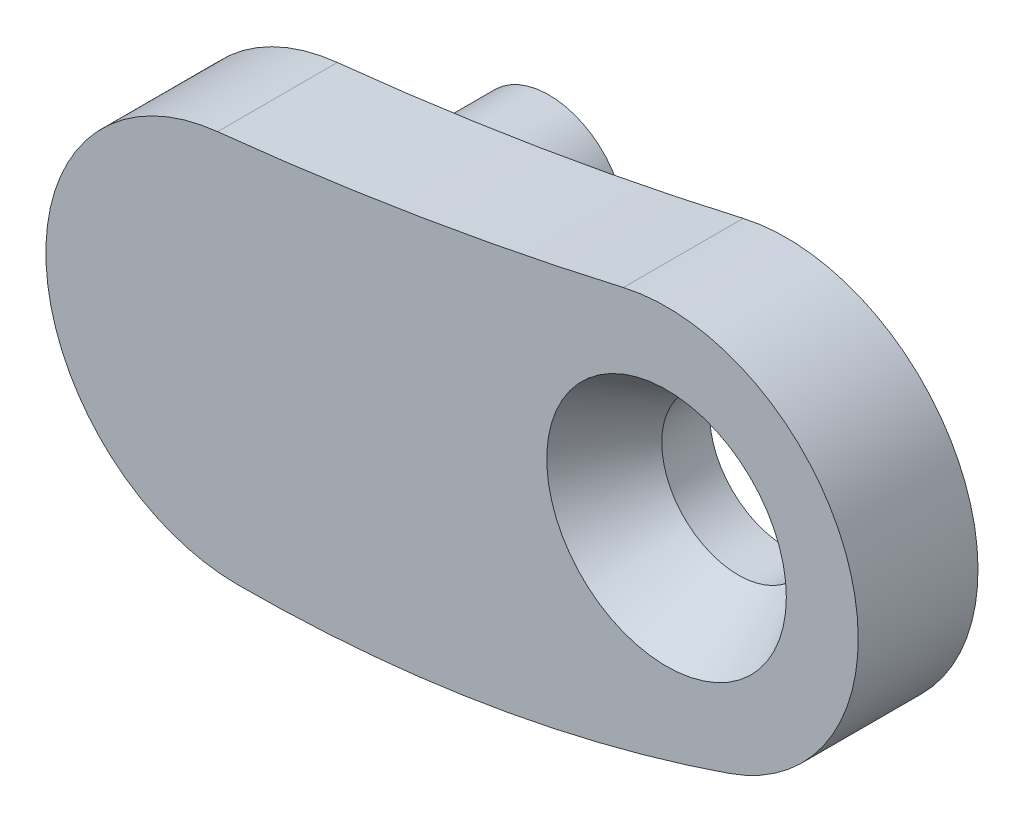
from build123d import *

# Parameters (mm, degrees)
SKETCH_1_R          = 1.6
EXTRUDE_1_DEPTH     = 3
SKETCH_2_R          = 1.6
EXTRUDE_2_DEPTH     = 4
CUT_EXTRUDE_START   = -0.5
CUT_EXTRUDE_1_DEPTH = 0.5


with BuildPart() as part:
    # 草图1 → 凸台-拉伸1 (new body)
    with BuildSketch(Plane.XY):
        with BuildLine():
            ThreePointArc((8.052200486, -22.104539206), (3.83936707, -22.943152918), (-0.416971099, -23.521792476))
            ThreePointArc((-0.416971099, -23.521792476), (-3.994548166, -27.708770095), (0, -31.5))
            ThreePointArc((0, -31.5), (5.198999585, -31.067996448), (10.255396865, -29.783835131))
            ThreePointArc((10.255396865, -29.783835131), (12.798012634, -24.898659157), (8.052200486, -22.104539206))
        make_face()
        with Locations((8.953124248, -26.001760829)):
            Circle(SKETCH_1_R, mode=Mode.SUBTRACT)
    extrude(amount=EXTRUDE_1_DEPTH)

    # 草图2 → 凸台-拉伸2 (add)
    with BuildSketch(Plane.XY):
        with Locations((0, -27.5)):
            Circle(SKETCH_2_R)
    extrude(amount=-EXTRUDE_2_DEPTH)

    # 草图3 → 切除-旋转1 (revolve, cut)
    with BuildSketch(Plane(origin=(0, -26.001760829, 0), x_dir=(1, 0, 0), z_dir=(0, 1, 0))):
        Polygon((8.953124248, -3.5), (5.853124248, -3.5), (7.353124248, -1), (8.953124248, -1), align=None)
    revolve(axis=Axis((8.953124248, -26.001760829, 1), (0, 0, 1)), mode=Mode.SUBTRACT)

    # 草图5 → 切除-拉伸1 (cut)
    with BuildSketch(Plane.XY.offset(3).offset(CUT_EXTRUDE_START)):
        with BuildLine():
            ThreePointArc((-0.416971099, -23.521792476), (-3.994548166, -27.708770095), (0, -31.5))
            ThreePointArc((0, -31.5), (5.198999585, -31.067996448), (10.255396865, -29.783835131))
            ThreePointArc((10.255396865, -29.783835131), (12.798012634, -24.898659157), (8.052200486, -22.104539206))
            ThreePointArc((8.052200486, -22.104539206), (3.83936707, -22.943152918), (-0.416971099, -23.521792476))
        make_face()
    extrude(amount=CUT_EXTRUDE_1_DEPTH, mode=Mode.SUBTRACT)


solid = part.part
